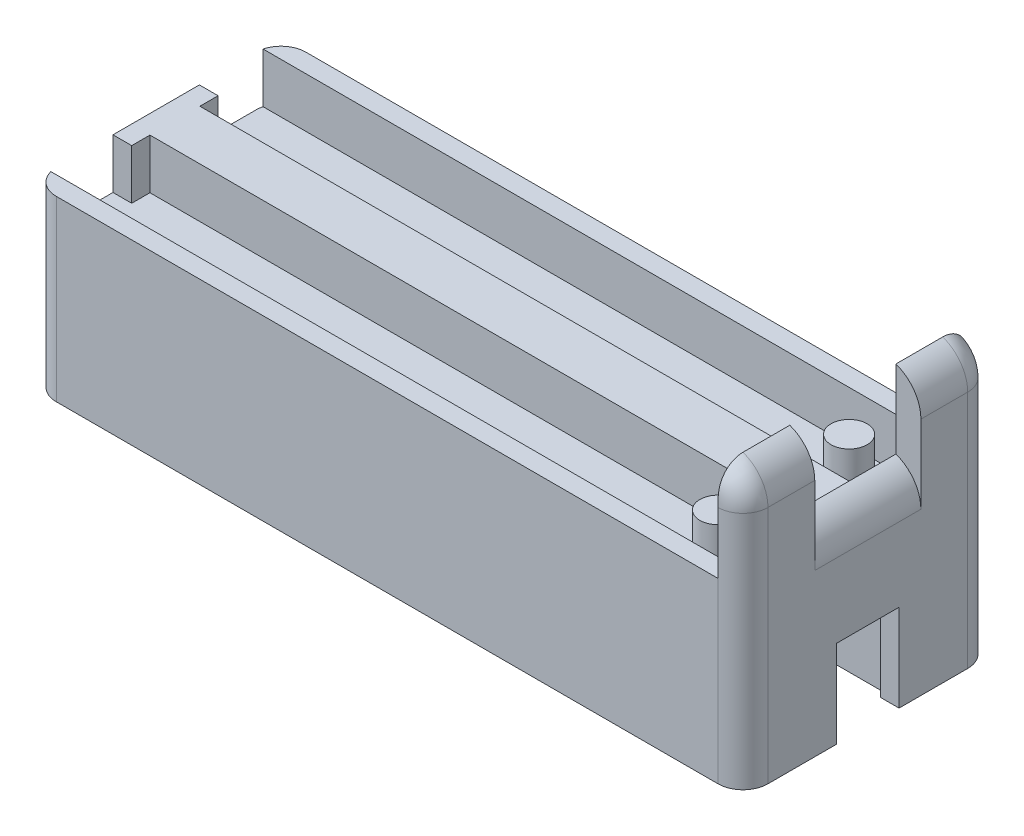
from build123d import *

# Parameters (mm, degrees)
SKETCH1_W              = 139.7
SKETCH1_H              = 50.8
BASE_DEPTH             = 8.255
MECHANISM_WALLS_DEPTH  = 10.16
SKETCH4_R              = 3.683
SPRING_CYLINDERS_DEPTH = 10.16
WALL_DEPTH             = 5.08
CIRCUIT_WALLS_DEPTH    = 17.78
SKETCH8_W              = 13.97
SKETCH8_H              = 13.97
MAGNET_JUNCTIONS_DEPTH = 17.78
MAGNET_HOLES_DEPTH     = 8.0772
SKETCH10_W             = 15
SKETCH10_H             = 43.18
BOSS_EXTRUDE1_DEPTH    = 5.334
FILLET1_R              = 7.62
FILLET2_R              = 5.08
FILLET4_R              = 7.62
FILLET5_R              = 5.08
SKETCH11_W             = 3.81
SKETCH11_H             = 10.16
CUT_EXTRUDE1_DEPTH     = 0.1016
SKETCH12_W             = 17.160016071
SKETCH12_H             = 10.16
CUT_EXTRUDE2_DEPTH     = 0.1016


# Some blends are built 0.0001 mm under size
with BuildPart() as part:
    # Sketch1 → base (new body)
    with BuildSketch(Plane(origin=(0, 0, 0), x_dir=(1, 0, 0), z_dir=(0, 1, 0))):
        Rectangle(SKETCH1_W, SKETCH1_H)
    extrude(amount=BASE_DEPTH)

    # Sketch3 → mechanism walls (add)
    with BuildSketch(Plane(origin=(0, 8.255, 0), x_dir=(1, 0, 0), z_dir=(0, 1, 0))):
        Polygon((69.85, 25.4), (-69.85, 25.4), (-69.85, 21.59), (66.04, 21.59), (66.04, 5.08), (-66.04, 5.08), (-66.04, 8.89), (-69.85, 8.89), (-69.85, -8.89), (-66.04, -8.89), (-66.04, -5.08), (66.04, -5.08), (66.04, -21.59), (-69.85, -21.59), (-69.85, -25.4), (69.85, -25.4), align=None)
    extrude(amount=MECHANISM_WALLS_DEPTH)

    # Sketch4 → spring cylinders (add)
    with BuildSketch(Plane(origin=(0, 8.255, 0), x_dir=(1, 0, 0), z_dir=(0, 1, 0))):
        with Locations(Location((57.785, 13.335, 0), (0, 0, 90))):
            Circle(SKETCH4_R)
        with Locations(Location((57.785, -13.335, 0), (0, 0, 90))):
            Circle(SKETCH4_R)
    extrude(amount=SPRING_CYLINDERS_DEPTH)

    # Sketch6 → wall (add)
    with BuildSketch(Plane(origin=(69.85, 0, 0), x_dir=(0, 0, -1), z_dir=(1, 0, 0))):
        Polygon((-25.4, 0), (25.4, 0), (25.4, 38.1), (10.795, 38.1), (10.795, 22.225), (-10.795, 22.225), (-10.795, 38.1), (-25.4, 38.1), align=None)
    extrude(amount=WALL_DEPTH)

    # Sketch7 → circuit walls (add)
    with BuildSketch(Plane.XZ):
        Polygon((74.93, 25.4), (74.93, 6.35), (71.12, 6.35), (71.12, 21.59), (-66.04, 21.59), (-66.04, -21.59), (71.12, -21.59), (71.12, -6.35), (74.93, -6.35), (74.93, -25.4), (-69.85, -25.4), (-69.85, 25.4), align=None)
    extrude(amount=CIRCUIT_WALLS_DEPTH)

    # Sketch8 → magnet junctions (add)
    with BuildSketch(Plane.XZ):
        with Locations((-59.055, 14.605)):
            Rectangle(SKETCH8_W, SKETCH8_H)
        with Locations((-59.055, -14.605)):
            Rectangle(SKETCH8_W, SKETCH8_H)
        with Locations((64.135, -14.605)):
            Rectangle(SKETCH8_W, SKETCH8_H)
        with Locations((64.135, 14.605)):
            Rectangle(SKETCH8_W, SKETCH8_H)
    extrude(amount=MAGNET_JUNCTIONS_DEPTH)

    # Sketch9 → magnet holes (cut)
    with BuildSketch(Plane.XZ.offset(17.78)):
        Polygon((-59.055, 19.297702988), (-63.119, 16.951351494), (-63.119, 12.258648506), (-59.055, 9.912297012), (-54.991, 12.258648506), (-54.991, 16.951351494), align=None)
        Polygon((-63.119, -12.258648506), (-59.055, -9.912297012), (-54.991, -12.258648506), (-54.991, -16.951351494), (-59.055, -19.297702988), (-63.119, -16.951351494), align=None)
        Polygon((64.135, 9.912297012), (60.071, 12.258648506), (60.071, 16.951351494), (64.135, 19.297702988), (68.199, 16.951351494), (68.199, 12.258648506), align=None)
        Polygon((64.135, -19.297702988), (68.199, -16.951351494), (68.199, -12.258648506), (64.135, -9.912297012), (60.071, -12.258648506), (60.071, -16.951351494), align=None)
    extrude(amount=-MAGNET_HOLES_DEPTH, mode=Mode.SUBTRACT)

    # Sketch10 → Boss-Extrude1 (add)
    with BuildSketch(Plane.XZ):
        with Locations((-44.57, 0)):
            Rectangle(SKETCH10_W, SKETCH10_H)
    extrude(amount=BOSS_EXTRUDE1_DEPTH)

    # Fillet1
    # the kernel refuses this fillet: 7.62 mm, written as the material it takes off along each edge
    with BuildSketch(Plane(origin=(74.93, 38.1, -43.360512242), x_dir=(0, -1, 0), z_dir=(0, 0, 1))) as fillet1_piece_1:
        with BuildLine():
            CenterArc((7.184204897, -7.62), FILLET1_R, 90, 70.528779366)
            Line((0, -5.08), (-0.143684098, -5.0292))
            ThreePointArc((-0.143684098, -5.0292), (-0.1524, -2.54), (-0.1524, 0))
            Line((-0.1524, 0), (0, 0.1524))
            Line((0, 0.1524), (7.184204897, 0.1524))
            Line((7.184204897, 0.1524), (7.184204897, 0))
        make_face()
    extrude(amount=50.526024484, mode=Mode.SUBTRACT)
    with BuildSketch(Plane(origin=(74.93, 38.1, -7.165512242), x_dir=(-1, 0, 0), z_dir=(0, 0, 1))) as fillet1_piece_2:
        with BuildLine():
            CenterArc((7.62, 7.184204897), FILLET1_R, 180, 70.528779366)
            Line((0, 7.184204897), (-0.1524, 7.184204897))
            Line((-0.1524, 7.184204897), (-0.1524, 0))
            Line((-0.1524, 0), (0, -0.1524))
            ThreePointArc((0, -0.1524), (2.54, -0.1524), (5.0292, -0.143684098))
            Line((5.0292, -0.143684098), (5.08, 0))
        make_face()
    extrude(amount=50.526024484, mode=Mode.SUBTRACT)

    # Fillet2
    fillet2_edges = [part.edges().sort_by_distance(p)[0] for p in [
        (74.93, 6.567897552, 25.4),
        (73.531703947, 35.315204154, -25.4),
        (73.531703947, 35.315204154, 25.4),
        (74.93, 6.567897552, -25.4),
    ]]
    fillet(fillet2_edges, radius=FILLET2_R - 0.0001)  # a hair under: the kernel refuses the full size

    # Fillet4
    # the kernel refuses this fillet: 7.62 mm, written as the material it takes off along each edge
    with BuildSketch(Plane(origin=(74.93, 22.225, -10.795), x_dir=(0, -1, 0), z_dir=(0, 0, 1))) as fillet4_piece_1:
        with BuildLine():
            CenterArc((7.184204897, -7.62), FILLET4_R, 90, 70.528779366)
            Line((0, -5.08), (-0.143684098, -5.0292))
            ThreePointArc((-0.143684098, -5.0292), (-0.1524, -2.54), (-0.1524, 0))
            Line((-0.1524, 0), (0, 0.1524))
            Line((0, 0.1524), (7.184204897, 0.1524))
            Line((7.184204897, 0.1524), (7.184204897, 0))
        make_face()
    extrude(amount=21.59, mode=Mode.SUBTRACT)

    # Fillet5
    fillet5_edges = [part.edges().sort_by_distance(p)[0] for p in [
        (-69.85, 0.3175, -25.4),
        (-69.85, 0.3175, 25.4),
    ]]
    fillet(fillet5_edges, radius=FILLET5_R)

    # Sketch11 → Cut-Extrude1 (cut)
    with BuildSketch(Plane.XY.offset(8.89)):
        with Locations((-67.945, 13.335)):
            Rectangle(SKETCH11_W, SKETCH11_H)
    extrude(amount=-CUT_EXTRUDE1_DEPTH, mode=Mode.SUBTRACT)

    # Sketch12 → Cut-Extrude2 (cut)
    with BuildSketch(Plane(origin=(0, 0, -8.89), x_dir=(-1, 0, 0), z_dir=(0, 0, -1))):
        with Locations((74.620008036, 13.335)):
            Rectangle(SKETCH12_W, SKETCH12_H)
    extrude(amount=-CUT_EXTRUDE2_DEPTH, mode=Mode.SUBTRACT)


solid = part.part
